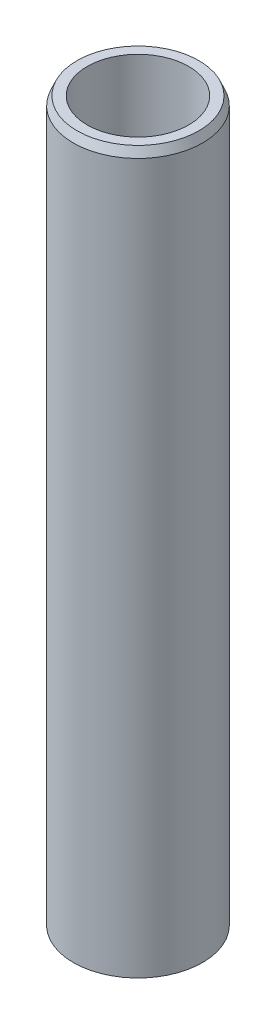
from build123d import *
from OCP.BRepFilletAPI import BRepFilletAPI_MakeChamfer

# Parameters (mm, degrees)
SKETCH1_R           = 32.5
BOSS_EXTRUDE1_DEPTH = 363.210754451
SKETCH2_R           = 25.526908411
CUT_EXTRUDE1_DEPTH  = 367.107295951
CHAMFER1_SIZE       = 4.360490072
CHAMFER1_SIZE2      = 1.885635733


with BuildPart() as part:
    # Sketch1 → Boss-Extrude1 (new body)
    with BuildSketch(Plane(origin=(0, 0, 0), x_dir=(1, 0, 0), z_dir=(0, 1, 0))):
        Circle(SKETCH1_R)
    extrude(amount=BOSS_EXTRUDE1_DEPTH)

    # Sketch2 → Cut-Extrude1 (cut, through all)
    with BuildSketch(Plane(origin=(0, 0, 0), x_dir=(1, 0, 0), z_dir=(0, 1, 0))):
        Circle(SKETCH2_R)
    extrude(amount=CUT_EXTRUDE1_DEPTH, mode=Mode.SUBTRACT)

    # Chamfer1: one chamfer whose edges measure the first distance from different faces: ONE call of the kernel's chamfer builder (chamfer() names one face for all edges)
    chamfer1_edges_1 = [part.edges().sort_by_distance(p)[0] for p in [
        (-32.5, 363.210754451, 0),
    ]]
    chamfer1_side_1 = [part.faces().sort_by_distance(p)[0] for p in [
        (-32.5, 181.605377225, 0),
    ]]
    chamfer1_edges_2 = [part.edges().sort_by_distance(p)[0] for p in [
        (-32.5, 0, 0),
    ]]
    chamfer1_side_2 = [part.faces().sort_by_distance(p)[0] for p in [
        (-31.580761184, 0, 0),
    ]]
    chamfer1 = BRepFilletAPI_MakeChamfer(part.part.solid().wrapped)
    for e in chamfer1_edges_1:
        chamfer1.Add(CHAMFER1_SIZE, CHAMFER1_SIZE2, e.wrapped, chamfer1_side_1[0].wrapped)  # the first distance lies on this face
    for e in chamfer1_edges_2:
        chamfer1.Add(CHAMFER1_SIZE, CHAMFER1_SIZE2, e.wrapped, chamfer1_side_2[0].wrapped)  # the first distance lies on this face
    add(Compound.cast(chamfer1.Shape()), mode=Mode.REPLACE)


solid = part.part
